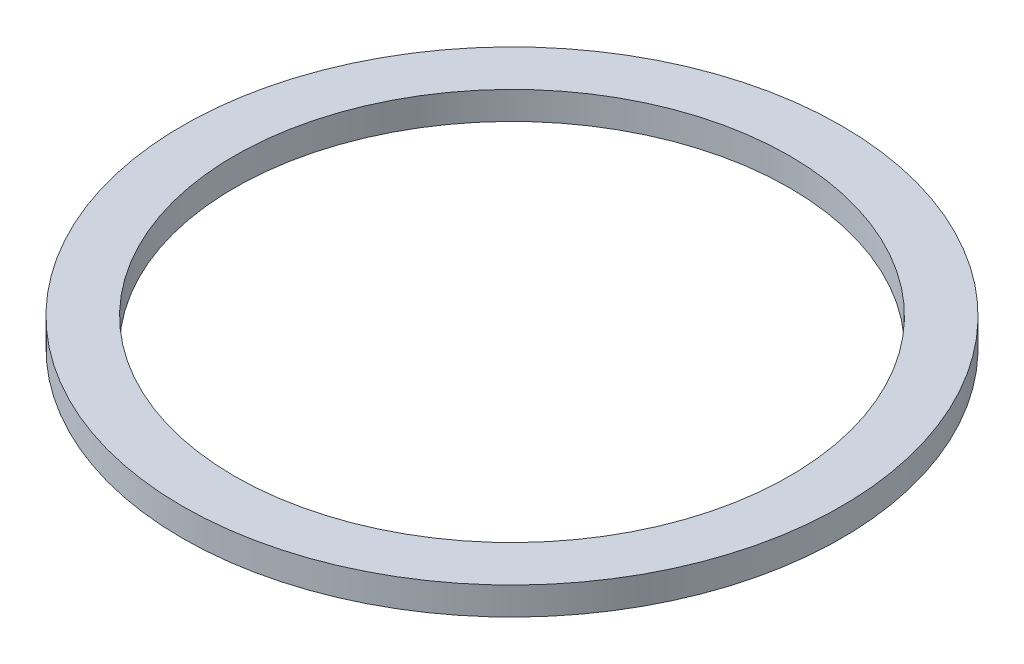
from build123d import *

# Parameters (mm, degrees)
SKETCH1_R           = 47.5
BOSS_EXTRUDE1_DEPTH = 4
SKETCH2_R           = 40
CUT_EXTRUDE1_DEPTH  = 68.294130502


with BuildPart() as part:
    # Sketch1 → Boss-Extrude1 (new body)
    with BuildSketch(Plane(origin=(0, 0, 0), x_dir=(1, 0, 0), z_dir=(0, 1, 0))):
        Circle(SKETCH1_R)
    extrude(amount=BOSS_EXTRUDE1_DEPTH)

    # Sketch2 → Cut-Extrude1 (cut, through all)
    with BuildSketch(Plane(origin=(0, 0, 0), x_dir=(1, 0, 0), z_dir=(0, 1, 0))):
        Circle(SKETCH2_R)
    extrude(amount=CUT_EXTRUDE1_DEPTH, mode=Mode.SUBTRACT)


solid = part.part
